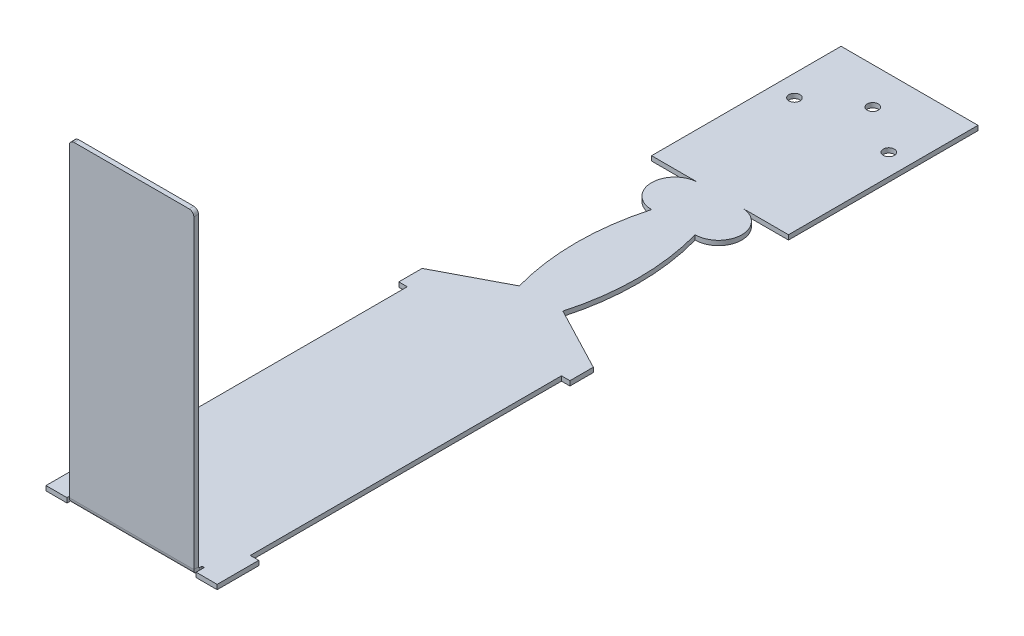
from build123d import *

# Parameters (mm, degrees)
BASE_FLANGE1_START                     = -3
BASE_FLANGE1_OUTLINE_W                 = 110
BASE_FLANGE1_OUTLINE_H                 = 500
BASE_FLANGE1_DEPTH                     = 3
T_LE_PLI_E_SUR_AR_TE1_STRIP_W          = 13.4732
T_LE_PLI_E_SUR_AR_TE1_STRIP_H          = 3
T_LE_PLI_E_SUR_AR_TE1_STRIP_CUT_DEPTH  = 80
T_LE_PLI_E_SUR_AR_TE1_RELIEF_W         = 14.9732
T_LE_PLI_E_SUR_AR_TE1_RELIEF_H         = 1.5
T_LE_PLI_E_SUR_AR_TE1_RELIEF_CUT_DEPTH = 3
T_LE_PLI_E_SUR_AR_TE1_DEPTH            = 80
FILLET2_R                              = 3
CUT_EXTRUDE2_DEPTH                     = 552.574796719
CUT_EXTRUDE2_DEPTH_BACK                = 3
F_7_1_7_1_DIAMETER_SLOT1_D             = 7.1
F_7_1_7_1_DIAMETER_SLOT1_DEPTH         = 3
F_7_1_7_1_DIAMETER_SLOT1_TIP           = 2.133055198


# Read off the part's stored shape, not the designer's step: Base-Flange1
# Sheet-metal steps are written as plain solids
with BuildPart() as part:
    # Base-Flange1 outline → Base-Flange1 (new body)
    with BuildSketch(Plane(origin=(0, 0, 0), x_dir=(1, 0, 0), z_dir=(0, 1, 0)).offset(BASE_FLANGE1_START)):
        with Locations((59.130435799, 250)):
            Rectangle(BASE_FLANGE1_OUTLINE_W, BASE_FLANGE1_OUTLINE_H)
    extrude(amount=BASE_FLANGE1_DEPTH)

    # Tôle pliée sur arête1 strip (across the edge) → Tôle pliée sur arête1 strip cut (cut)
    with BuildSketch(Plane(origin=(19.130435799, 0, 0), x_dir=(0, 0, -1), z_dir=(1, 0, 0))):
        with Locations((-3, -1.5)):
            Rectangle(T_LE_PLI_E_SUR_AR_TE1_STRIP_W, T_LE_PLI_E_SUR_AR_TE1_STRIP_H)
    extrude(amount=T_LE_PLI_E_SUR_AR_TE1_STRIP_CUT_DEPTH, mode=Mode.SUBTRACT)

    # Tôle pliée sur arête1 relief (on the sheet) → Tôle pliée sur arête1 relief cut (cut)
    with BuildSketch(Plane(origin=(19.130435799, 0, -3.7366), x_dir=(0, 0, -1), z_dir=(0, 1, 0))):
        with Locations((-5.9866, 0.75)):
            Rectangle(T_LE_PLI_E_SUR_AR_TE1_RELIEF_W, T_LE_PLI_E_SUR_AR_TE1_RELIEF_H)
        with Locations((-5.9866, -80.75)):
            Rectangle(T_LE_PLI_E_SUR_AR_TE1_RELIEF_W, T_LE_PLI_E_SUR_AR_TE1_RELIEF_H)
    extrude(amount=-T_LE_PLI_E_SUR_AR_TE1_RELIEF_CUT_DEPTH, mode=Mode.SUBTRACT)

    # Tôle pliée sur arête1 section (across the edge) → Tôle pliée sur arête1 (add)
    with BuildSketch(Plane(origin=(19.130435799, 0, 0), x_dir=(0, 0, -1), z_dir=(1, 0, 0))):
        with BuildLine():
            Line((0, 0.7366), (0, 200))
            Line((0, 200), (3, 200))
            Line((3, 200), (3, 0.7366))
            ThreePointArc((3, 0.7366), (3.215745145, 0.215745145), (3.7366, 0))
            Line((3.7366, 0), (3.7366, -3))
            ThreePointArc((3.7366, -3), (1.094424801, -1.905575199), (0, 0.7366))
        make_face()
    extrude(amount=T_LE_PLI_E_SUR_AR_TE1_DEPTH)

    # Fillet2
    fillet2_edges = [part.edges().sort_by_distance(p)[0] for p in [
        (19.130435799, 200, -1.5),
        (99.130435799, 200, -1.5),
        (4.130435799, -1.5, -500),
        (114.130435799, -1.5, -500),
    ]]
    fillet(fillet2_edges, radius=FILLET2_R)

    # Sketch14 → Cut-Extrude2 (cut, two sides: drawn at the far end of the back side and taken through both)
    with BuildSketch(Plane.XZ.offset(3).offset(-CUT_EXTRUDE2_DEPTH_BACK)):
        with BuildLine():
            Line((1095.888112959, -26.7366), (114.130435799, -26.7366))
            Line((114.130435799, -26.7366), (108.694609025, -26.7366))
            Line((108.694609025, -26.7366), (108.694609025, -226.7366))
            Line((108.694609025, -226.7366), (114.130435799, -226.7366))
            Line((114.130435799, -226.7366), (114.130435799, -241.7366))
            Line((114.130435799, -241.7366), (73.130435799, -263.202647067))
            ThreePointArc((73.130435799, -263.202647067), (78.953729303, -305.702647067), (73.130435799, -348.202647067))
            ThreePointArc((73.130435799, -348.202647067), (88.130435799, -363.202647067), (73.130435799, -378.202647067))
            Line((73.130435799, -378.202647067), (103.130435799, -378.202647067))
            Line((103.130435799, -378.202647067), (103.130435799, -500))
            Line((103.130435799, -500), (15.130435799, -500))
            Line((15.130435799, -500), (15.130435799, -378.202647067))
            Line((15.130435799, -378.202647067), (45.130435799, -378.202647067))
            ThreePointArc((45.130435799, -378.202647067), (30.130435799, -363.202647067), (45.130435799, -348.202647067))
            ThreePointArc((45.130435799, -348.202647067), (39.307142295, -305.702647067), (45.130435799, -263.202647067))
            Line((45.130435799, -263.202647067), (4.130435799, -241.7366))
            Line((4.130435799, -241.7366), (4.130435799, -226.7366))
            Line((4.130435799, -226.7366), (9.566262574, -226.7366))
            Line((9.566262574, -226.7366), (9.566262574, -26.7366))
            Line((9.566262574, -26.7366), (4.130435799, -26.7366))
            Line((4.130435799, -26.7366), (-977.62724136, -26.7366))
            Line((-977.62724136, -26.7366), (-977.62724136, -1990.251954319))
            Line((-977.62724136, -1990.251954319), (1095.888112959, -1990.251954319))
            Line((1095.888112959, -1990.251954319), (1095.888112959, -26.7366))
        make_face()
    extrude(amount=CUT_EXTRUDE2_DEPTH + CUT_EXTRUDE2_DEPTH_BACK, mode=Mode.SUBTRACT)

    # Ø7.1 (7.1) Diameter Slot1
    with Locations(Plane(origin=(0, -3, 0), x_dir=(-1, 0, 0), z_dir=(0, -1, 0))):
        with Locations((-59.130435799, 476.35), (-89.450435799, 456.35), (-28.810435799, 456.35)):
            Hole(F_7_1_7_1_DIAMETER_SLOT1_D / 2, depth=F_7_1_7_1_DIAMETER_SLOT1_DEPTH)
            with Locations((0, 0, -(F_7_1_7_1_DIAMETER_SLOT1_DEPTH + F_7_1_7_1_DIAMETER_SLOT1_TIP / 2))):  # 118° drill point
                Cone(0, F_7_1_7_1_DIAMETER_SLOT1_D / 2, F_7_1_7_1_DIAMETER_SLOT1_TIP, mode=Mode.SUBTRACT)


solid = part.part
